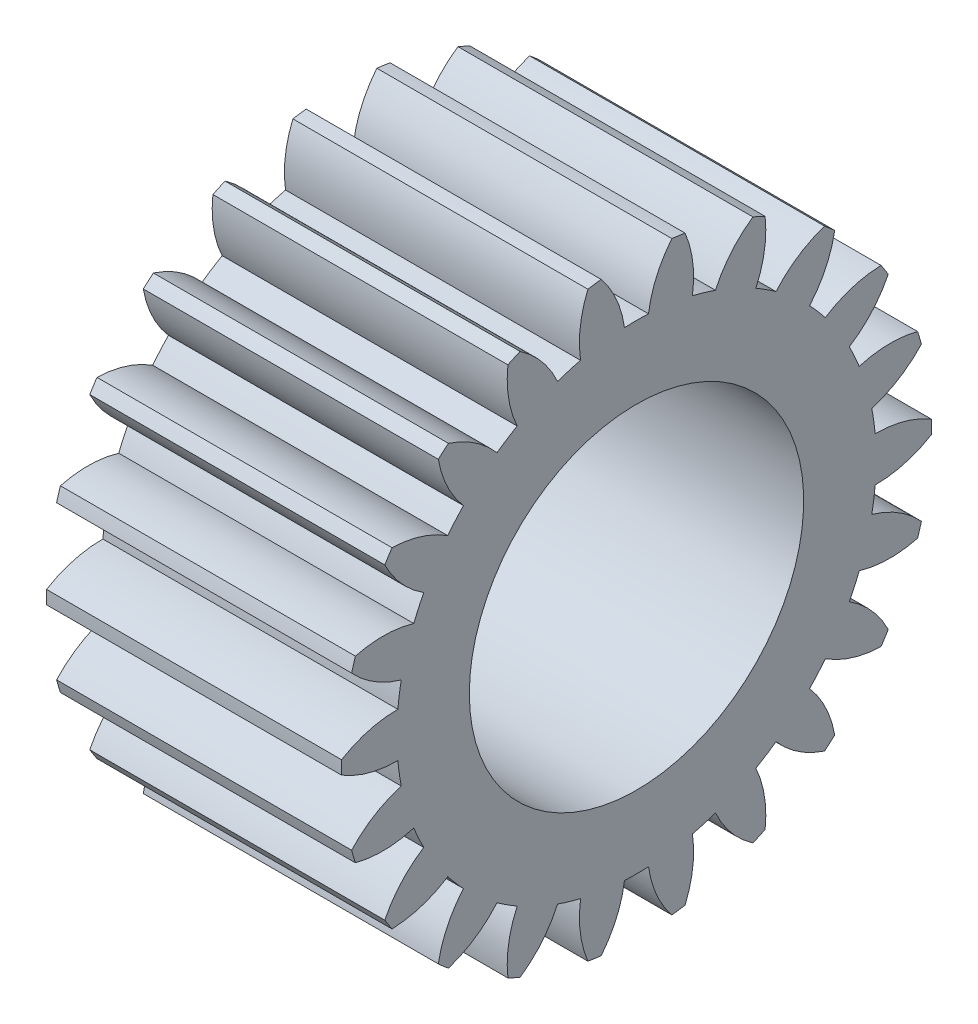
from build123d import *

# Parameters (mm, degrees)
BASPROSKE_W     = 15
BASPROSKE_H     = 15
TOOTHCUT_DEPTH  = 26.980762114
TEETHCUTS_COUNT = 22
TEETHCUTS_ANGLE = 343.636363636
BORSKE_R        = 8.5
BORE_DEPTH      = 50.0000508


with BuildPart() as part:
    # BasProSke → Base-Revolve (revolve)
    with BuildSketch(Plane(origin=(0, 0, 0), x_dir=(1, 0, 0), z_dir=(0, 1, 0))):
        with Locations((7.5, 7.5)):
            Rectangle(BASPROSKE_W, BASPROSKE_H)
    revolve(axis=Axis((-10, 0, 0), (1, 0, 0)))

    # TooCutSke → ToothCut (cut, through all)
    with BuildSketch(Plane(origin=(0, 0, 0), x_dir=(0, 0, -1), z_dir=(1, 0, 0))):
        with BuildLine():
            ThreePointArc((0.609906099, 12.171228237), (0, 12.1865), (-0.609906099, 12.171228237))
            ThreePointArc((-0.609906099, 12.171228237), (-1.022716454, 13.626997902), (-1.81660957, 14.915179343))
            ThreePointArc((-1.81660957, 14.915179343), (0, 15.0254), (1.81660957, 14.915179343))
            ThreePointArc((1.81660957, 14.915179343), (1.022716454, 13.626997902), (0.609906099, 12.171228237))
        make_face()
    toothcut = extrude(amount=TOOTHCUT_DEPTH, mode=Mode.SUBTRACT)

    # TeethCuts: ToothCut ×22 about axis
    teethcuts_axis = Axis((-10, 0, 0), (1, 0, 0))
    for i in range(1, TEETHCUTS_COUNT):
        add(toothcut.rotate(teethcuts_axis, i * TEETHCUTS_ANGLE / (TEETHCUTS_COUNT - 1)), mode=Mode.SUBTRACT)

    # BorSke → Bore (cut, symmetric)
    with BuildSketch(Plane(origin=(0, 0, 0), x_dir=(0, 0, -1), z_dir=(1, 0, 0))):
        Circle(BORSKE_R)
    extrude(amount=BORE_DEPTH, both=True, mode=Mode.SUBTRACT)


solid = part.part
